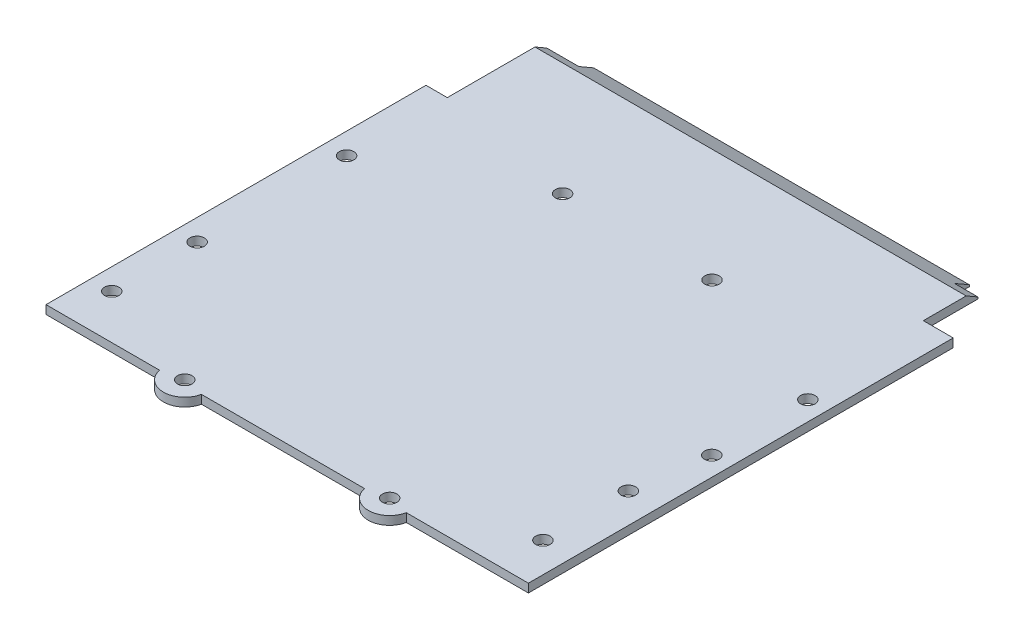
from build123d import *

# Parameters (mm, degrees)
SKETCH_1_W           = 113
SKETCH_1_H           = 113
EXTRUDE_1_DEPTH      = 3
CUT_EXTRUDE_1_REACH  = 161.834
SKETCH_2_R           = 1.7
SKETCH_3_W           = 90
SKETCH_3_H           = 105
EXTRUDE_2_DEPTH      = 2
SKETCH_5_R           = 5
EXTRUDE_3_DEPTH      = 3
CUT_EXTRUDE_2_REACH  = 161.834
SKETCH_6_R           = 1.7
CUT_EXTRUDE_3_REACH  = 161.834
SKETCH_7_R           = 1.7
CUT_EXTRUDE_4_REACH  = 161.884
SKETCH_8_R           = 1.7
EXTRUDE_5_DEPTH      = 90
CUT_EXTRUDE_5_DEPTH  = 2
SKETCH_13_W          = 2
SKETCH_13_H          = 12
EXTRUDE_6_DEPTH      = 11.5
CUT_EXTRUDE_6_REACH  = 162.612
SKETCH_14_R          = 1.7
CUT_EXTRUDE_7_REACH  = 164.681
EXTRUDE_7_DEPTH      = 8.5
SKETCH_17_W          = 2
SKETCH_17_H          = 11.5
EXTRUDE_8_DEPTH      = 3
FILLET_1_R           = 1
CUT_EXTRUDE_8_DEPTH  = 163.681089759
SKETCH_20_W          = 113
SKETCH_20_H          = 12.124355653
CUT_EXTRUDE_9_DEPTH  = 1
CHAMFER_1_SIZE       = 1
SKETCH_21_W          = 7
SKETCH_21_H          = 13.5
CUT_EXTRUDE_10_DEPTH = 163.681089759
SKETCH_22_W          = 5
SKETCH_22_H          = 24
CUT_EXTRUDE_11_DEPTH = 163.681089759
SKETCH_23_W          = 2
SKETCH_23_H          = 19.464101615
CUT_EXTRUDE_12_DEPTH = 2
CHAMFER_2_SIZE       = 2
SKETCH_24_W          = 0.692820323
SKETCH_24_H          = 0.4
CUT_EXTRUDE_13_DEPTH = 95.5
SKETCH_25_W          = 0.692820323
SKETCH_25_H          = 0.4
CUT_EXTRUDE_14_DEPTH = 5.5
SKETCH_26_W          = 0.692820323
SKETCH_26_H          = 0.4
CUT_EXTRUDE_15_DEPTH = 7.5
SKETCH_27_W          = 113
SKETCH_27_H          = 105.875644347
CUT_EXTRUDE_16_DEPTH = 163.339889035
SKETCH_29_W          = 10
SKETCH_29_H          = 5
CUT_EXTRUDE_17_DEPTH = 163.185818036
SKETCH_30_W          = 10
SKETCH_30_H          = 2
CUT_EXTRUDE_18_DEPTH = 37
SKETCH_31_W          = 10
SKETCH_31_H          = 27
EXTRUDE_9_DEPTH      = 1


with BuildPart() as part:
    # 草图1 → 凸台-拉伸1 (new body)
    with BuildSketch(Plane(origin=(0, 0, 0), x_dir=(1, 0, 0), z_dir=(0, 1, 0))):
        with Locations((56.5, 56.5)):
            Rectangle(SKETCH_1_W, SKETCH_1_H)
    extrude(amount=EXTRUDE_1_DEPTH)

    # 草图2 → 切除-拉伸1 (cut, up to next)
    with BuildSketch(Plane(origin=(0, 3, 0), x_dir=(1, 0, 0), z_dir=(0, 1, 0)), mode=Mode.PRIVATE) as cut_extrude_1_sk1:
        with Locations(Location((108.5, 69.95, 0), (0, 0, 270))):
            Circle(SKETCH_2_R)
    cut_extrude_1_tool1 = extrude(cut_extrude_1_sk1.sketch, amount=-CUT_EXTRUDE_1_REACH, mode=Mode.PRIVATE) & part.part
    # 草图2 → 切除-拉伸1 (cut, up to next)
    with BuildSketch(Plane(origin=(0, 3, 0), x_dir=(1, 0, 0), z_dir=(0, 1, 0)), mode=Mode.PRIVATE) as cut_extrude_1_sk2:
        with Locations(Location((108.5, 47.45, 0), (0, 0, 270))):
            Circle(SKETCH_2_R)
    cut_extrude_1_tool2 = extrude(cut_extrude_1_sk2.sketch, amount=-CUT_EXTRUDE_1_REACH, mode=Mode.PRIVATE) & part.part
    # 草图2 → 切除-拉伸1 (cut, up to next)
    with BuildSketch(Plane(origin=(0, 3, 0), x_dir=(1, 0, 0), z_dir=(0, 1, 0)), mode=Mode.PRIVATE) as cut_extrude_1_sk3:
        with Locations(Location((106, 30.4, 0), (0, 0, 270))):
            Circle(SKETCH_2_R)
    cut_extrude_1_tool3 = extrude(cut_extrude_1_sk3.sketch, amount=-CUT_EXTRUDE_1_REACH, mode=Mode.PRIVATE) & part.part
    # 草图2 → 切除-拉伸1 (cut, up to next)
    with BuildSketch(Plane(origin=(0, 3, 0), x_dir=(1, 0, 0), z_dir=(0, 1, 0)), mode=Mode.PRIVATE) as cut_extrude_1_sk4:
        with Locations(Location((106, 10.4, 0), (0, 0, 270))):
            Circle(SKETCH_2_R)
    cut_extrude_1_tool4 = extrude(cut_extrude_1_sk4.sketch, amount=-CUT_EXTRUDE_1_REACH, mode=Mode.PRIVATE) & part.part
    add(cut_extrude_1_tool1.solids().sort_by_distance((108.5, 3, -69.95))[0], mode=Mode.SUBTRACT)
    add(cut_extrude_1_tool2.solids().sort_by_distance((108.5, 3, -47.45))[0], mode=Mode.SUBTRACT)
    add(cut_extrude_1_tool3.solids().sort_by_distance((106, 3, -30.4))[0], mode=Mode.SUBTRACT)
    add(cut_extrude_1_tool4.solids().sort_by_distance((106, 3, -10.4))[0], mode=Mode.SUBTRACT)

    # 草图3 → 凸台-拉伸2 (add)
    with BuildSketch(Plane(origin=(0, 0, 0), x_dir=(1, 0, 0), z_dir=(0, 1, 0))):
        with Locations((55.5, 60.5)):
            Rectangle(SKETCH_3_W, SKETCH_3_H)
    extrude(amount=-EXTRUDE_2_DEPTH)

    # 草图5 → 凸台-拉伸3 (add)
    with BuildSketch(Plane.XZ):
        with Locations((79.5, -1)):
            Circle(SKETCH_5_R)
        with Locations((31.5, -1)):
            Circle(SKETCH_5_R)
    extrude(amount=-EXTRUDE_3_DEPTH)

    # 草图6 → 切除-拉伸2 (cut, up to next)
    with BuildSketch(Plane.XZ, mode=Mode.PRIVATE) as cut_extrude_2_sk1:
        with Locations(Location((31.5, -1, 0), (0, 0, 270))):
            Circle(SKETCH_6_R)
    cut_extrude_2_tool1 = extrude(cut_extrude_2_sk1.sketch, amount=-CUT_EXTRUDE_2_REACH, mode=Mode.PRIVATE) & part.part
    # 草图6 → 切除-拉伸2 (cut, up to next)
    with BuildSketch(Plane.XZ, mode=Mode.PRIVATE) as cut_extrude_2_sk2:
        with Locations(Location((79.5, -1, 0), (0, 0, 270))):
            Circle(SKETCH_6_R)
    cut_extrude_2_tool2 = extrude(cut_extrude_2_sk2.sketch, amount=-CUT_EXTRUDE_2_REACH, mode=Mode.PRIVATE) & part.part
    add(cut_extrude_2_tool1.solids().sort_by_distance((31.5, 0, -1))[0], mode=Mode.SUBTRACT)
    add(cut_extrude_2_tool2.solids().sort_by_distance((79.5, 0, -1))[0], mode=Mode.SUBTRACT)

    # 草图7 → 切除-拉伸3 (cut, up to next)
    with BuildSketch(Plane.XZ, mode=Mode.PRIVATE) as cut_extrude_3_sk1:
        with Locations(Location((5, -10.4, 0), (0, 0, 270))):
            Circle(SKETCH_7_R)
    cut_extrude_3_tool1 = extrude(cut_extrude_3_sk1.sketch, amount=-CUT_EXTRUDE_3_REACH, mode=Mode.PRIVATE) & part.part
    # 草图7 → 切除-拉伸3 (cut, up to next)
    with BuildSketch(Plane.XZ, mode=Mode.PRIVATE) as cut_extrude_3_sk2:
        with Locations(Location((5, -30.4, 0), (0, 0, 270))):
            Circle(SKETCH_7_R)
    cut_extrude_3_tool2 = extrude(cut_extrude_3_sk2.sketch, amount=-CUT_EXTRUDE_3_REACH, mode=Mode.PRIVATE) & part.part
    # 草图7 → 切除-拉伸3 (cut, up to next)
    with BuildSketch(Plane.XZ, mode=Mode.PRIVATE) as cut_extrude_3_sk3:
        with Locations(Location((5, -65.4, 0), (0, 0, 270))):
            Circle(SKETCH_7_R)
    cut_extrude_3_tool3 = extrude(cut_extrude_3_sk3.sketch, amount=-CUT_EXTRUDE_3_REACH, mode=Mode.PRIVATE) & part.part
    add(cut_extrude_3_tool1.solids().sort_by_distance((5, 0, -10.4))[0], mode=Mode.SUBTRACT)
    add(cut_extrude_3_tool2.solids().sort_by_distance((5, 0, -30.4))[0], mode=Mode.SUBTRACT)
    add(cut_extrude_3_tool3.solids().sort_by_distance((5, 0, -65.4))[0], mode=Mode.SUBTRACT)

    # 草图8 → 切除-拉伸4 (cut, up to next)
    with BuildSketch(Plane.XZ.offset(2), mode=Mode.PRIVATE) as cut_extrude_4_sk1:
        with Locations(Location((38, -83, 0), (0, 0, 270))):
            Circle(SKETCH_8_R)
    cut_extrude_4_tool1 = extrude(cut_extrude_4_sk1.sketch, amount=-CUT_EXTRUDE_4_REACH, mode=Mode.PRIVATE) & part.part
    # 草图8 → 切除-拉伸4 (cut, up to next)
    with BuildSketch(Plane.XZ.offset(2), mode=Mode.PRIVATE) as cut_extrude_4_sk2:
        with Locations(Location((73, -83, 0), (0, 0, 270))):
            Circle(SKETCH_8_R)
    cut_extrude_4_tool2 = extrude(cut_extrude_4_sk2.sketch, amount=-CUT_EXTRUDE_4_REACH, mode=Mode.PRIVATE) & part.part
    add(cut_extrude_4_tool1.solids().sort_by_distance((38, -2, -83))[0], mode=Mode.SUBTRACT)
    add(cut_extrude_4_tool2.solids().sort_by_distance((73, -2, -83))[0], mode=Mode.SUBTRACT)

    # 草图10 → 凸台-拉伸5 (add)
    with BuildSketch(Plane(origin=(100.5, 0, 0), x_dir=(0, 0, -1), z_dir=(1, 0, 0))):
        Polygon((113, 0), (116.464101615, -2), (113, -2), align=None)
    extrude(amount=-EXTRUDE_5_DEPTH)

    # 草图11 → 切除-拉伸5 (cut)
    with BuildSketch(Plane(origin=(0, -2, 0), x_dir=(1, 0, 0), z_dir=(0, 1, 0))):
        with BuildLine():
            Line((33, 83), (33, 53))
            ThreePointArc((33, 53), (38, 48), (43, 53))
            Line((43, 53), (43, 83))
            ThreePointArc((43, 83), (38, 88), (33, 83))
        make_face()
        with BuildLine():
            Line((68, 83), (68, 53))
            ThreePointArc((68, 53), (73, 48), (78, 53))
            Line((78, 53), (78, 83))
            ThreePointArc((78, 83), (73, 88), (68, 83))
        make_face()
    extrude(amount=CUT_EXTRUDE_5_DEPTH, mode=Mode.SUBTRACT)

    # 草图13 → 凸台-拉伸6 (add)
    with BuildSketch(Plane.XZ):
        with Locations((4, -83)):
            Rectangle(SKETCH_13_W, SKETCH_13_H)
    extrude(amount=EXTRUDE_6_DEPTH)

    # 草图14 → 切除-拉伸6 (cut, up to next)
    with BuildSketch(Plane.ZY.offset(-3), mode=Mode.PRIVATE) as cut_extrude_6_sk1:
        with Locations((-83.5, -5)):
            Circle(SKETCH_14_R)
    cut_extrude_6_tool1 = extrude(cut_extrude_6_sk1.sketch, amount=-CUT_EXTRUDE_6_REACH, mode=Mode.PRIVATE) & part.part
    add(cut_extrude_6_tool1.solids().sort_by_distance((3, -5, -83.5))[0], mode=Mode.SUBTRACT)

    # 草图15 → 切除-拉伸7 (cut, up to next)
    with BuildSketch(Plane.XZ, mode=Mode.PRIVATE) as cut_extrude_7_sk1:
        Polygon((113, -100.875644347), (106, -113), (113, -113), align=None)
    cut_extrude_7_tool1 = extrude(cut_extrude_7_sk1.sketch, amount=-CUT_EXTRUDE_7_REACH, mode=Mode.PRIVATE) & part.part
    add(cut_extrude_7_tool1.solids().sort_by_distance((110.666667, 0, -108.958548))[0], mode=Mode.SUBTRACT)

    # 草图16 → 凸台-拉伸7 (add)
    with BuildSketch(Plane.XZ):
        Polygon((113, -99.5), (107.5, -99.5), (107.5, -110.401923789), (113, -100.875644347), align=None)
    extrude(amount=EXTRUDE_7_DEPTH)

    # 草图17 → 凸台-拉伸8 (add)
    with BuildSketch(Plane.ZY.offset(-3)):
        with Locations((-78, -5.75)):
            Rectangle(SKETCH_17_W, SKETCH_17_H)
    extrude(amount=EXTRUDE_8_DEPTH)

    # 圆角1
    fillet_1_edges = [part.edges().sort_by_distance(p)[0] for p in [
        (3, -5.75, -79),
    ]]
    fillet(fillet_1_edges, radius=FILLET_1_R)

    # 草图19 → 切除-拉伸8 (cut, through all)
    with BuildSketch(Plane.ZY):
        Polygon((-113, 0), (-107.803847577, 3), (-113, 3), align=None)
    extrude(amount=-CUT_EXTRUDE_8_DEPTH, mode=Mode.SUBTRACT)

    # 草图20 → 切除-拉伸9 (cut)
    with BuildSketch(Plane(origin=(0, 3, 0), x_dir=(1, 0, 0), z_dir=(0, 1, 0))):
        with Locations((56.5, 106.937822173)):
            Rectangle(SKETCH_20_W, SKETCH_20_H)
    extrude(amount=-CUT_EXTRUDE_9_DEPTH, mode=Mode.SUBTRACT)

    # 倒角1
    chamfer_1_edges = [part.edges().sort_by_distance(p)[0] for p in [
        (56.5, 2, -100.875644347),
    ]]
    chamfer(chamfer_1_edges, length=CHAMFER_1_SIZE - 0.0001)  # a hair under: the kernel refuses the full size

    # 草图21 → 切除-拉伸10 (cut, through all)
    with BuildSketch(Plane.XZ.offset(8.5)):
        with Locations((109.5, -106.25)):
            Rectangle(SKETCH_21_W, SKETCH_21_H)
    extrude(amount=-CUT_EXTRUDE_10_DEPTH, mode=Mode.SUBTRACT)

    # 草图22 → 切除-拉伸11 (cut, through all)
    with BuildSketch(Plane.XZ):
        with Locations((2.5, -101)):
            Rectangle(SKETCH_22_W, SKETCH_22_H)
    extrude(amount=-CUT_EXTRUDE_11_DEPTH, mode=Mode.SUBTRACT)

    # 草图23 → 切除-拉伸12 (cut)
    with BuildSketch(Plane.XZ.offset(2)):
        with Locations((11.5, -106.732050808)):
            Rectangle(SKETCH_23_W, SKETCH_23_H)
    extrude(amount=-CUT_EXTRUDE_12_DEPTH, mode=Mode.SUBTRACT)

    # 倒角2
    chamfer_2_edges = [part.edges().sort_by_distance(p)[0] for p in [
        (10.5, -1, -97),
    ]]
    chamfer(chamfer_2_edges, length=CHAMFER_2_SIZE - 0.0001)  # a hair under: the kernel refuses the full size

    # 草图24 → 切除-拉伸13 (cut)
    with BuildSketch(Plane(origin=(100.5, 0, 0), x_dir=(0, 0, -1), z_dir=(1, 0, 0))):
        with Locations((116.117691454, -1.8)):
            Rectangle(SKETCH_24_W, SKETCH_24_H)
    extrude(amount=-CUT_EXTRUDE_13_DEPTH, mode=Mode.SUBTRACT)

    # 草图25 → 切除-拉伸14 (cut)
    with BuildSketch(Plane(origin=(106, 0, 0), x_dir=(0, 0, -1), z_dir=(1, 0, 0))):
        with Locations((112.653589839, 0.2)):
            Rectangle(SKETCH_25_W, SKETCH_25_H)
    extrude(amount=-CUT_EXTRUDE_14_DEPTH, mode=Mode.SUBTRACT)

    # 草图26 → 切除-拉伸15 (cut)
    with BuildSketch(Plane.ZY.offset(-5)):
        with Locations((-112.653589839, 0.2)):
            Rectangle(SKETCH_26_W, SKETCH_26_H)
    extrude(amount=-CUT_EXTRUDE_15_DEPTH, mode=Mode.SUBTRACT)

    # 草图27 → 切除-拉伸16 (cut, through all)
    with BuildSketch(Plane(origin=(0, 2, 0), x_dir=(1, 0, 0), z_dir=(0, 1, 0))):
        with Locations((56.5, 48.937822174)):
            Rectangle(SKETCH_27_W, SKETCH_27_H)
    extrude(amount=CUT_EXTRUDE_16_DEPTH, mode=Mode.SUBTRACT)

    # 草图29 → 切除-拉伸17 (cut, through all)
    with BuildSketch(Plane.XZ):
        with Locations((38, -50.5)):
            Rectangle(SKETCH_29_W, SKETCH_29_H)
        with Locations((73, -50.5)):
            Rectangle(SKETCH_29_W, SKETCH_29_H)
    extrude(amount=CUT_EXTRUDE_17_DEPTH, mode=Mode.SUBTRACT)

    # 草图30 → 切除-拉伸18 (cut)
    with BuildSketch(Plane(origin=(0, 0, -48), x_dir=(-1, 0, 0), z_dir=(0, 0, -1))):
        with Locations((-38, -1)):
            Rectangle(SKETCH_30_W, SKETCH_30_H)
        with Locations((-73, -1)):
            Rectangle(SKETCH_30_W, SKETCH_30_H)
    extrude(amount=-CUT_EXTRUDE_18_DEPTH, mode=Mode.SUBTRACT)

    # 草图31 → 凸台-拉伸9 (add)
    with BuildSketch(Plane.XZ):
        with Locations((38, -24.5)):
            Rectangle(SKETCH_31_W, SKETCH_31_H)
        with Locations((73, -24.5)):
            Rectangle(SKETCH_31_W, SKETCH_31_H)
    extrude(amount=EXTRUDE_9_DEPTH)


solid = part.part
